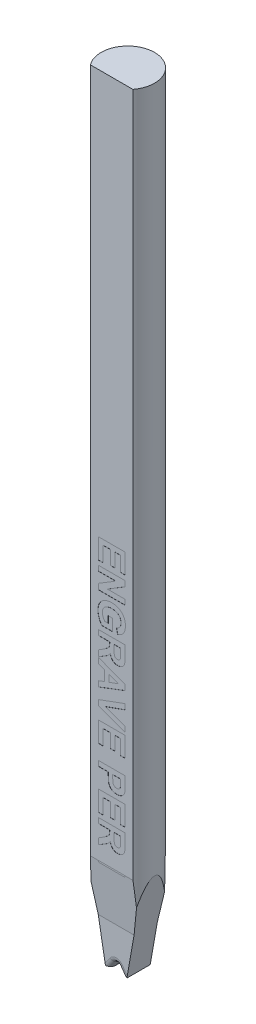
from build123d import *

# Parameters (mm, degrees)
SKETCH_TL_CUTTING_R       = 0.99695
TL_CUTTING_DEPTH          = 29.0068
SKETCH_TDF_GRINDING_W     = 2.0139
SKETCH_TDF_GRINDING_H     = 2.0139
TDF_GRINDING_DEPTH        = 30.041044486
ENGRAVING_DEPTH           = 0.005
VW_VR_GRINDING_DEPTH      = 1.00695
VW_VR_GRINDING_DEPTH_BACK = 1.00695
ISA_GRINDING_DEPTH        = 1.00695
ISA_GRINDING_DEPTH_BACK   = 1.00695
PRE_FRX_BRX_DEPTH         = 1.00695
PRE_FRX_BRX_DEPTH_BACK    = 1.00695
SKETCH_PRE_FRX_BRX_W      = 0.57134
SKETCH_PRE_FRX_BRX_H      = 1.524
FR_EDM_R                  = 0.20066
BR_EDM_R                  = 0.20066
FA_BA_GRINDING_DEPTH      = 1.00695
FA_BA_GRINDING_DEPTH_BACK = 1.00695


with BuildPart() as part:
    # sketch_TL_cutting → TL_cutting (new body)
    with BuildSketch(Plane(origin=(0, 0, 0), x_dir=(1, 0, 0), z_dir=(0, 1, 0))):
        Circle(SKETCH_TL_CUTTING_R)
    extrude(amount=TL_CUTTING_DEPTH)

    # sketch_TDF_grinding → TDF_grinding (cut, through all)
    with BuildSketch(Plane(origin=(0, 0, 0), x_dir=(1, 0, 0), z_dir=(0, 1, 0))):
        with Locations((0, -1.6102)):
            Rectangle(SKETCH_TDF_GRINDING_W, SKETCH_TDF_GRINDING_H)
    extrude(amount=TDF_GRINDING_DEPTH, mode=Mode.SUBTRACT)

    # sketch_engraving → engraving (cut)
    # profile 1 of 13: a face of its own
    with BuildSketch(Plane.XY.offset(0.60325)):
        Polygon((-0.5, 13.904235897), (0.5, 13.904235897), (0.5, 13.160646154), (0.333333333, 13.160646154), (0.333333333, 13.711928205), (0.115384615, 13.711928205), (0.115384615, 13.199107692), (-0.051282051, 13.199107692), (-0.051282051, 13.711928205), (-0.333333333, 13.711928205), (-0.333333333, 13.147825641), (-0.5, 13.147825641), align=None)
    # profile 2 of 13: a face of its own
    with BuildSketch(Plane.XY.offset(0.60325)):
        Polygon((-0.5, 12.981158974), (0.5, 12.981158974), (0.5, 12.7802375), (-0.157451923, 12.378594872), (0.5, 12.378594872), (0.5, 12.186287179), (-0.5, 12.186287179), (-0.5, 12.39341859), (0.147035256, 12.788851282), (-0.5, 12.788851282), align=None)
    # profile 3 of 13: a face of its own
    with BuildSketch(Plane.XY.offset(0.60325)):
        with BuildLine():
            Line((-0.128205128, 11.532441026), (0.038461538, 11.532441026))
            Line((0.038461538, 11.532441026), (0.038461538, 11.09654359))
            Line((0.038461538, 11.09654359), (-0.36338141, 11.09654359))
            add(Edge.make_bspline(
                [(-0.36338141, 11.09654359), (-0.368321434, 11.102029605), (-0.378419843, 11.113244131), (-0.392661125, 11.131541895), (-0.406257259, 11.15168601), (-0.4194836, 11.1735547), (-0.432233696, 11.197193223), (-0.444685123, 11.222507295), (-0.45671611, 11.249543622), (-0.471787381, 11.287776941), (-0.488186169, 11.336991061), (-0.502445448, 11.397156306), (-0.511191227, 11.457797498), (-0.512277771, 11.498358306), (-0.512820513, 11.51861891)],
                knots=[0, 0, 0, 0, 0.581799769, 1.189316438, 1.825828404, 2.496525428, 3.203088405, 3.942228803, 4.719818701, 5.534979611, 7.181138583, 8.803804008, 10.403462225, 12, 12, 12, 12], degree=3))
            add(Edge.make_bspline(
                [(-0.512820513, 11.51861891), (-0.512629241, 11.531311396), (-0.512252188, 11.556332062), (-0.509233571, 11.593270349), (-0.504017902, 11.628987455), (-0.496780719, 11.663419967), (-0.487836372, 11.696670877), (-0.476607913, 11.728623396), (-0.463065488, 11.759243299), (-0.447986133, 11.788759812), (-0.430657849, 11.816612408), (-0.411724289, 11.842856254), (-0.390891397, 11.867236635), (-0.36853351, 11.889965448), (-0.344060025, 11.910614033), (-0.318106216, 11.929695872), (-0.290219674, 11.946754268), (-0.260879177, 11.96208079), (-0.230317098, 11.975710173), (-0.198781008, 11.987212477), (-0.166726875, 11.997296153), (-0.134042675, 12.005583938), (-0.10062201, 12.011670885), (-0.066619552, 12.01640276), (-0.031822841, 12.018944234), (-0.008417054, 12.019393556), (0.003405449, 12.019620513)],
                knots=[0, 0, 0, 0, 1.124897971, 2.217508473, 3.282174662, 4.322209414, 5.334422951, 6.332119154, 7.320662553, 8.300074908, 9.267468154, 10.225199689, 11.165658754, 12.107290334, 13.047749399, 14.00069605, 14.959944213, 15.942088746, 16.933021067, 17.923599838, 18.915715637, 19.910475908, 20.909926025, 21.925232038, 22.952013513, 24, 24, 24, 24], degree=3))
            add(Edge.make_bspline(
                [(0.003405449, 12.019620513), (0.016165747, 12.019436614), (0.041321811, 12.019074069), (0.078501182, 12.015944425), (0.114594914, 12.01109647), (0.149519517, 12.003701478), (0.183523729, 11.994848027), (0.216299841, 11.983503339), (0.248180515, 11.970549892), (0.278688999, 11.955265774), (0.308028284, 11.938383202), (0.335510174, 11.919199631), (0.361403632, 11.89838003), (0.385591047, 11.875737199), (0.407627145, 11.850898237), (0.428063784, 11.824372539), (0.447146094, 11.79617769), (0.457908016, 11.776000967), (0.463341346, 11.765814423)],
                knots=[0, 0, 0, 0, 1.105132952, 2.178694671, 3.229818344, 4.257558797, 5.269123684, 6.27148554, 7.259679084, 8.247804916, 9.224967877, 10.189258471, 11.147685264, 12.101072275, 13.055511435, 14.02039165, 15.000562851, 16, 16, 16, 16], degree=3))
            add(Edge.make_bspline(
                [(0.463341346, 11.765814423), (0.467347168, 11.757727072), (0.475455657, 11.741356849), (0.485329628, 11.715283756), (0.494054347, 11.687916179), (0.500719187, 11.658934703), (0.506115234, 11.628648224), (0.510216979, 11.596907147), (0.512307439, 11.563652939), (0.512647258, 11.540990515), (0.512820513, 11.529436218)],
                knots=[0, 0, 0, 0, 0.887950456, 1.797368171, 2.741221183, 3.713797788, 4.722103116, 5.768966405, 6.862521341, 8, 8, 8, 8], degree=3))
            add(Edge.make_bspline(
                [(0.512820513, 11.529436218), (0.512598613, 11.514538718), (0.512167059, 11.485565835), (0.508571106, 11.443325541), (0.502373597, 11.403571904), (0.493837942, 11.366249565), (0.482863355, 11.331438928), (0.469371425, 11.299199918), (0.453633675, 11.26933466), (0.435019378, 11.242275716), (0.414494937, 11.217473149), (0.392035387, 11.19499168), (0.367607461, 11.174822262), (0.341334074, 11.156951549), (0.313106625, 11.141520198), (0.283182558, 11.128252182), (0.251334696, 11.117331), (0.22921692, 11.112053034), (0.217948718, 11.109364103)],
                knots=[0, 0, 0, 0, 1.271135529, 2.472123572, 3.614091059, 4.701890498, 5.736279567, 6.724681829, 7.680621489, 8.611506429, 9.52200816, 10.424540711, 11.318996785, 12.221421405, 13.131851814, 14.060431888, 15.011860567, 16, 16, 16, 16], degree=3))
            Line((0.217948718, 11.109364103), (0.179487179, 11.301671795))
            add(Edge.make_bspline(
                [(0.179487179, 11.301671795), (0.185798707, 11.303574377), (0.198251232, 11.307328136), (0.216108293, 11.314634712), (0.232994438, 11.322952834), (0.248643132, 11.332779827), (0.263649233, 11.343217482), (0.277161531, 11.355487665), (0.290187329, 11.368394684), (0.301701762, 11.38288584), (0.312086782, 11.398324395), (0.321450083, 11.414545863), (0.329043783, 11.431914205), (0.335153652, 11.450186828), (0.340342569, 11.469274233), (0.343533767, 11.489425571), (0.345940549, 11.51041453), (0.346081986, 11.524754556), (0.346153846, 11.532040385)],
                knots=[0, 0, 0, 0, 1.027780279, 2.027791312, 3.006028774, 3.96000864, 4.908113241, 5.852721087, 6.802883308, 7.765918715, 8.733730415, 9.704005314, 10.683351261, 11.68471758, 12.707948499, 13.764514378, 14.864202456, 16, 16, 16, 16], degree=3))
            add(Edge.make_bspline(
                [(0.346153846, 11.532040385), (0.345859633, 11.543067741), (0.34528545, 11.564588568), (0.341538784, 11.596006107), (0.334873123, 11.625645672), (0.325679114, 11.65358477), (0.313877959, 11.679874621), (0.299029501, 11.704159968), (0.282012344, 11.727045501), (0.262039987, 11.747879978), (0.239645267, 11.766774481), (0.214561065, 11.783131053), (0.186868462, 11.79674783), (0.156706511, 11.807900746), (0.124073954, 11.816780847), (0.088855272, 11.822804995), (0.051104495, 11.826741063), (0.02505068, 11.827118323), (0.01161859, 11.827312821)],
                knots=[0, 0, 0, 0, 1.043810997, 2.037086103, 2.989314757, 3.91471467, 4.817033861, 5.710208705, 6.603920097, 7.511448416, 8.435617211, 9.371747005, 10.338444094, 11.350425613, 12.411431869, 13.5347293, 14.729025275, 16, 16, 16, 16], degree=3))
            add(Edge.make_bspline(
                [(0.01161859, 11.827312821), (-0.002813331, 11.827110147), (-0.03086261, 11.826716238), (-0.071503034, 11.822881337), (-0.109371212, 11.816583116), (-0.14440027, 11.807515757), (-0.176807311, 11.796208494), (-0.206438048, 11.782228966), (-0.233109204, 11.76542113), (-0.256980675, 11.746358295), (-0.278169336, 11.725321484), (-0.296147735, 11.702258524), (-0.31184176, 11.678000317), (-0.32420794, 11.651860517), (-0.33413508, 11.624312028), (-0.341078682, 11.595085999), (-0.345395871, 11.564287729), (-0.345897627, 11.543206176), (-0.346153846, 11.532441026)],
                knots=[0, 0, 0, 0, 1.31821493, 2.562027667, 3.72541598, 4.821825939, 5.863743127, 6.857000185, 7.808227391, 8.737146514, 9.643023621, 10.529087527, 11.404035307, 12.277173472, 13.164790074, 14.074766194, 15.016892606, 16, 16, 16, 16], degree=3))
            add(Edge.make_bspline(
                [(-0.346153846, 11.532441026), (-0.345850315, 11.521537735), (-0.34524035, 11.499626847), (-0.340086045, 11.466805767), (-0.332449955, 11.433805514), (-0.321065283, 11.401413163), (-0.307937779, 11.370026456), (-0.292687307, 11.340860255), (-0.276962331, 11.313467677), (-0.264654274, 11.2969552), (-0.258613782, 11.288851282)],
                knots=[0, 0, 0, 0, 0.993779204, 1.997065276, 3.023588959, 4.078879359, 5.123947549, 6.123456565, 7.079038607, 8, 8, 8, 8], degree=3))
            Line((-0.258613782, 11.288851282), (-0.128205128, 11.288851282))
            Line((-0.128205128, 11.288851282), (-0.128205128, 11.532441026))
        make_face()
    # profile 4 of 13: a face of its own
    with BuildSketch(Plane.XY.offset(0.60325)):
        with BuildLine():
            Line((-0.5, 10.904235897), (0.5, 10.904235897))
            Line((0.5, 10.904235897), (0.5, 10.484564423))
            add(Edge.make_bspline(
                [(0.5, 10.484564423), (0.499921351, 10.471810201), (0.499769781, 10.447230481), (0.498665723, 10.411683268), (0.496349389, 10.378901265), (0.493735057, 10.348736822), (0.489890849, 10.321277094), (0.485377151, 10.296456079), (0.480042652, 10.274353829), (0.473762142, 10.2547266), (0.46640441, 10.236899938), (0.457825047, 10.220235326), (0.447696774, 10.204575272), (0.436444977, 10.189714477), (0.424039539, 10.175595254), (0.410155618, 10.162603274), (0.394999014, 10.150512567), (0.378696089, 10.139332781), (0.361318758, 10.129484096), (0.343425117, 10.120484982), (0.324824746, 10.113159364), (0.305605269, 10.10710847), (0.285808412, 10.102274923), (0.265383845, 10.098920032), (0.244368538, 10.096825611), (0.230173307, 10.096638641), (0.222956731, 10.09654359)],
                knots=[0, 0, 0, 0, 1.675792322, 3.229558513, 4.671612708, 5.993327294, 7.206773438, 8.313218507, 9.306927966, 10.191988363, 11.018030861, 11.838135071, 12.650980327, 13.465150207, 14.285535933, 15.117196726, 15.959844754, 16.83101188, 17.711363548, 18.582398133, 19.460517458, 20.334551361, 21.228266118, 22.135486512, 23.052118027, 24, 24, 24, 24], degree=3))
            add(Edge.make_bspline(
                [(0.222956731, 10.09654359), (0.213865176, 10.09671771), (0.196097772, 10.097057988), (0.170067915, 10.100259374), (0.145135532, 10.104860931), (0.121515047, 10.111974247), (0.099028777, 10.120818829), (0.077834712, 10.131624821), (0.057734109, 10.144377691), (0.039011166, 10.159143067), (0.021628172, 10.175861702), (0.005964946, 10.194627919), (-0.008142217, 10.215317705), (-0.020271369, 10.238100383), (-0.030960543, 10.262583224), (-0.039742833, 10.289088699), (-0.046961528, 10.31748005), (-0.050349413, 10.337234525), (-0.052083333, 10.347344872)],
                knots=[0, 0, 0, 0, 1.059179627, 2.069928931, 3.052909591, 4.01082991, 4.940120368, 5.865982481, 6.779263376, 7.710344595, 8.640547144, 9.585223395, 10.554458868, 11.553878165, 12.589111246, 13.664634927, 14.804759383, 16, 16, 16, 16], degree=3))
            add(Edge.make_bspline(
                [(-0.052083333, 10.347344872), (-0.058543192, 10.337554557), (-0.071157156, 10.318437315), (-0.092244136, 10.292140986), (-0.113935974, 10.268182324), (-0.13350323, 10.250195798), (-0.150629326, 10.236361316), (-0.165615492, 10.225228495), (-0.182859981, 10.213217912), (-0.202374991, 10.20044991), (-0.22398696, 10.186546224), (-0.248026974, 10.172024206), (-0.274260457, 10.156579885), (-0.292585876, 10.146196031), (-0.302083333, 10.140814423)],
                knots=[0, 0, 0, 0, 1.285482994, 2.510122655, 3.691653098, 4.826411195, 5.419869803, 6.105175889, 6.872935239, 7.723789235, 8.662129684, 9.690525463, 10.803075916, 12, 12, 12, 12], degree=3))
            Line((-0.302083333, 10.140814423), (-0.5, 10.019620513))
            Line((-0.5, 10.019620513), (-0.5, 10.244380128))
            Line((-0.5, 10.244380128), (-0.273036859, 10.386607692))
            add(Edge.make_bspline(
                [(-0.273036859, 10.386607692), (-0.263945443, 10.393137401), (-0.24658806, 10.405603957), (-0.221949287, 10.42363509), (-0.199893124, 10.440036608), (-0.1805544, 10.454827372), (-0.163731826, 10.467827709), (-0.149845803, 10.479482343), (-0.138230202, 10.489219639), (-0.126725879, 10.500254127), (-0.114887633, 10.513080533), (-0.103494307, 10.528942305), (-0.094238036, 10.545123543), (-0.087286311, 10.56262809), (-0.082478883, 10.582919627), (-0.079343719, 10.607279092), (-0.077067211, 10.636432144), (-0.076973557, 10.657502303), (-0.076923077, 10.668859295)],
                knots=[0, 0, 0, 0, 1.465382114, 2.797715724, 3.99708711, 5.063614826, 5.985194575, 6.779875669, 7.43696127, 7.968700361, 8.866038685, 9.717629234, 10.520014012, 11.30082289, 12.174340694, 13.242479345, 14.513673363, 16, 16, 16, 16], degree=3))
            Line((-0.076923077, 10.668859295), (-0.076923077, 10.711928205))
            Line((-0.076923077, 10.711928205), (-0.5, 10.711928205))
            Line((-0.5, 10.711928205), (-0.5, 10.904235897))
        make_face()
        with BuildLine():
            Line((0.08974359, 10.711928205), (0.08974359, 10.557080449))
            add(Edge.make_bspline(
                [(0.08974359, 10.557080449), (0.089768957, 10.5451274), (0.089817287, 10.522354821), (0.090527354, 10.489971991), (0.091115821, 10.461109113), (0.09265079, 10.435809153), (0.094114881, 10.414019334), (0.096069001, 10.395767128), (0.09836301, 10.381028848), (0.101931469, 10.366307986), (0.108148092, 10.351228202), (0.117003495, 10.335158518), (0.128487921, 10.321415466), (0.141777239, 10.309542986), (0.157332372, 10.300378485), (0.174706183, 10.293657484), (0.193862841, 10.289643774), (0.20724563, 10.289120802), (0.214142628, 10.288851282)],
                knots=[0, 0, 0, 0, 1.698120923, 3.235207303, 4.601799022, 5.7989489, 6.835765357, 7.704239165, 8.40605236, 8.953649664, 9.852072573, 10.714567413, 11.550246753, 12.383769498, 13.234656382, 14.099651817, 15.020630301, 16, 16, 16, 16], degree=3))
            add(Edge.make_bspline(
                [(0.214142628, 10.288851282), (0.221852989, 10.28918604), (0.236728888, 10.2898319), (0.257822961, 10.295086949), (0.27662771, 10.303834428), (0.292813882, 10.316323618), (0.306623576, 10.33192236), (0.317392842, 10.350646681), (0.325576055, 10.372091747), (0.328565774, 10.387545804), (0.330128205, 10.395622115)],
                knots=[0, 0, 0, 0, 1.062451802, 2.049829439, 2.976851779, 3.903462222, 4.849641532, 5.832195941, 6.867102576, 8, 8, 8, 8], degree=3))
            add(Edge.make_bspline(
                [(0.330128205, 10.395622115), (0.330421459, 10.398291011), (0.331116534, 10.404616853), (0.331562949, 10.415787541), (0.332249138, 10.430070698), (0.332529569, 10.447639208), (0.333021138, 10.468336115), (0.333111403, 10.492243719), (0.333399792, 10.519286063), (0.333356297, 10.538383752), (0.333333333, 10.548466667)],
                knots=[0, 0, 0, 0, 0.42127143, 0.998501726, 1.753681744, 2.66564073, 3.755712164, 5.002818897, 6.417592707, 8, 8, 8, 8], degree=3))
            Line((0.333333333, 10.548466667), (0.333333333, 10.711928205))
            Line((0.333333333, 10.711928205), (0.08974359, 10.711928205))
        make_face(mode=Mode.SUBTRACT)
    # profile 5 of 13: a face of its own
    with BuildSketch(Plane.XY.offset(0.60325)):
        Polygon((-0.5, 9.045261538), (-0.5, 9.249187821), (-0.269230769, 9.333522756), (-0.269230769, 9.717336859), (-0.5, 9.801671795), (-0.5, 10.0068), (0.5, 9.628795192), (0.5, 9.425069231), align=None)
        Polygon((-0.102564103, 9.394620513), (0.256410256, 9.526030769), (-0.102564103, 9.657040385), align=None, mode=Mode.SUBTRACT)
    # profile 6 of 13: a face of its own
    with BuildSketch(Plane.XY.offset(0.60325)):
        Polygon((-0.5, 8.637008333), (0.5, 9.0068), (0.5, 8.803675), (-0.243589744, 8.538851282), (0.5, 8.275029167), (0.5, 8.070902564), (-0.5, 8.439291987), align=None)
    # profile 7 of 13: a face of its own
    with BuildSketch(Plane.XY.offset(0.60325)):
        Polygon((-0.5, 7.981158974), (0.5, 7.981158974), (0.5, 7.237569231), (0.333333333, 7.237569231), (0.333333333, 7.788851282), (0.115384615, 7.788851282), (0.115384615, 7.276030769), (-0.051282051, 7.276030769), (-0.051282051, 7.788851282), (-0.333333333, 7.788851282), (-0.333333333, 7.224748718), (-0.5, 7.224748718), align=None)
    # profile 8 of 13: a face of its own
    with BuildSketch(Plane.XY.offset(0.60325)):
        with BuildLine():
            Line((-0.5, 6.673466667), (0.5, 6.673466667))
            Line((0.5, 6.673466667), (0.5, 6.353554808))
            add(Edge.make_bspline(
                [(0.5, 6.353554808), (0.4999852, 6.339064455), (0.499956962, 6.311416693), (0.499104777, 6.271884062), (0.497929464, 6.236289855), (0.496434625, 6.204622803), (0.494248137, 6.176966334), (0.491629455, 6.153258956), (0.488933209, 6.133391744), (0.486060508, 6.121634128), (0.484775641, 6.116375321)],
                knots=[0, 0, 0, 0, 1.460492613, 2.786636817, 3.985312262, 5.05006335, 5.98179196, 6.7807735, 7.454678796, 8, 8, 8, 8], degree=3))
            add(Edge.make_bspline(
                [(0.484775641, 6.116375321), (0.482781564, 6.109381959), (0.478823789, 6.095501776), (0.470386441, 6.075615803), (0.460608006, 6.05644887), (0.448953875, 6.038241805), (0.435630967, 6.020932663), (0.420747869, 6.004470188), (0.404237636, 5.988765844), (0.386131953, 5.974039765), (0.366525691, 5.960543742), (0.345376234, 5.948912401), (0.322847402, 5.939051925), (0.298873329, 5.931127517), (0.273610941, 5.924575617), (0.246834559, 5.920393024), (0.218752408, 5.917369504), (0.199528035, 5.9171623), (0.189703526, 5.91705641)],
                knots=[0, 0, 0, 0, 0.907183394, 1.800546498, 2.691728384, 3.591410291, 4.495216108, 5.416087871, 6.359626967, 7.337496937, 8.327236581, 9.327316132, 10.346534403, 11.393207653, 12.477041209, 13.600953845, 14.773980723, 16, 16, 16, 16], degree=3))
            add(Edge.make_bspline(
                [(0.189703526, 5.91705641), (0.174784734, 5.917364918), (0.146065241, 5.917958813), (0.104894137, 5.924608263), (0.067280604, 5.934741168), (0.03361575, 5.949582122), (0.003633111, 5.967595209), (-0.023091697, 5.987763014), (-0.046492635, 6.010246245), (-0.066210989, 6.034825478), (-0.082434, 6.060756803), (-0.096247437, 6.086755341), (-0.106871469, 6.113146515), (-0.11149992, 6.13114078), (-0.113782051, 6.140013141)],
                knots=[0, 0, 0, 0, 1.312446177, 2.526530956, 3.662051072, 4.733637382, 5.754065268, 6.735959421, 7.675686778, 8.604015004, 9.502732733, 10.365317746, 11.193993632, 12, 12, 12, 12], degree=3))
            add(Edge.make_bspline(
                [(-0.113782051, 6.140013141), (-0.114986663, 6.146345752), (-0.11752584, 6.159694139), (-0.120056937, 6.180863883), (-0.122858586, 6.204003561), (-0.124685978, 6.229208347), (-0.126397255, 6.25644775), (-0.127205205, 6.285711194), (-0.128178621, 6.316956857), (-0.128196112, 6.338463031), (-0.128205128, 6.349548397)],
                knots=[0, 0, 0, 0, 0.735353946, 1.55003838, 2.431865514, 3.394945452, 4.432993119, 5.54609699, 6.735134699, 8, 8, 8, 8], degree=3))
            Line((-0.128205128, 6.349548397), (-0.128205128, 6.481158974))
            Line((-0.128205128, 6.481158974), (-0.5, 6.481158974))
            Line((-0.5, 6.481158974), (-0.5, 6.673466667))
        make_face()
        with BuildLine():
            Line((0.333333333, 6.481158974), (0.038461538, 6.481158974))
            Line((0.038461538, 6.481158974), (0.038461538, 6.365774359))
            add(Edge.make_bspline(
                [(0.038461538, 6.365774359), (0.038474423, 6.355824233), (0.038499073, 6.33678839), (0.039383856, 6.309476178), (0.040463899, 6.284753138), (0.04225159, 6.262567611), (0.044607724, 6.243053517), (0.047425958, 6.226080173), (0.050450217, 6.211627797), (0.055461898, 6.19599952), (0.063570342, 6.179289767), (0.075224213, 6.161445715), (0.089157789, 6.145769737), (0.105522293, 6.132725245), (0.123704204, 6.122305583), (0.143517189, 6.114845099), (0.164632877, 6.11002787), (0.179260262, 6.109587861), (0.186698718, 6.109364103)],
                knots=[0, 0, 0, 0, 1.411705958, 2.700771114, 3.876961699, 4.922619712, 5.858038221, 6.66485904, 7.363650596, 7.950905807, 8.989198271, 9.987739806, 10.967313358, 11.951275539, 12.944273208, 13.927870418, 14.946261014, 16, 16, 16, 16], degree=3))
            add(Edge.make_bspline(
                [(0.186698718, 6.109364103), (0.195758642, 6.109679017), (0.213324639, 6.110289596), (0.238341551, 6.11702257), (0.261044702, 6.127410781), (0.280727694, 6.142262972), (0.297279472, 6.16020407), (0.31105114, 6.180369116), (0.320688658, 6.203188742), (0.32442284, 6.219338921), (0.326322115, 6.227553205)],
                knots=[0, 0, 0, 0, 1.085904563, 2.105425768, 3.088705091, 4.068969419, 5.045188284, 6.010769642, 6.988240112, 8, 8, 8, 8], degree=3))
            add(Edge.make_bspline(
                [(0.326322115, 6.227553205), (0.326887477, 6.231087999), (0.328142404, 6.238934146), (0.329452077, 6.251976039), (0.330643223, 6.267404601), (0.331621189, 6.285238428), (0.332385732, 6.305406833), (0.333055661, 6.32797634), (0.333109481, 6.352887507), (0.333256648, 6.37031512), (0.333333333, 6.379396154)],
                knots=[0, 0, 0, 0, 0.564603001, 1.253243608, 2.066786758, 3.005752288, 4.070476343, 5.250658742, 6.567396469, 8, 8, 8, 8], degree=3))
            Line((0.333333333, 6.379396154), (0.333333333, 6.481158974))
        make_face(mode=Mode.SUBTRACT)
    # profile 9 of 13: a face of its own
    with BuildSketch(Plane.XY.offset(0.60325)):
        Polygon((-0.5, 5.750389744), (0.5, 5.750389744), (0.5, 5.0068), (0.333333333, 5.0068), (0.333333333, 5.558082051), (0.115384615, 5.558082051), (0.115384615, 5.045261538), (-0.051282051, 5.045261538), (-0.051282051, 5.558082051), (-0.333333333, 5.558082051), (-0.333333333, 4.993979487), (-0.5, 4.993979487), align=None)
    # profile 10 of 13: a face of its own
    with BuildSketch(Plane.XY.offset(0.60325)):
        with BuildLine():
            Line((-0.5, 4.827312821), (0.5, 4.827312821))
            Line((0.5, 4.827312821), (0.5, 4.407641346))
            add(Edge.make_bspline(
                [(0.5, 4.407641346), (0.499921351, 4.394887124), (0.499769781, 4.370307404), (0.498665723, 4.334760191), (0.496349389, 4.301978188), (0.493735057, 4.271813745), (0.489890849, 4.244354017), (0.485377151, 4.219533002), (0.480042652, 4.197430752), (0.473762142, 4.177803523), (0.46640441, 4.159976861), (0.457825047, 4.143312249), (0.447696774, 4.127652195), (0.436444977, 4.1127914), (0.424039539, 4.098672178), (0.410155618, 4.085680198), (0.394999014, 4.07358949), (0.378696089, 4.062409704), (0.361318758, 4.052561019), (0.343425117, 4.043561905), (0.324824746, 4.036236287), (0.305605269, 4.030185393), (0.285808412, 4.025351846), (0.265383845, 4.021996956), (0.244368538, 4.019902534), (0.230173307, 4.019715564), (0.222956731, 4.019620513)],
                knots=[0, 0, 0, 0, 1.675792322, 3.229558513, 4.671612708, 5.993327294, 7.206773438, 8.313218507, 9.306927966, 10.191988363, 11.018030861, 11.838135071, 12.650980327, 13.465150207, 14.285535933, 15.117196726, 15.959844754, 16.83101188, 17.711363548, 18.582398133, 19.460517458, 20.334551361, 21.228266118, 22.135486512, 23.052118027, 24, 24, 24, 24], degree=3))
            add(Edge.make_bspline(
                [(0.222956731, 4.019620513), (0.213865176, 4.019794633), (0.196097772, 4.020134911), (0.170067915, 4.023336297), (0.145135532, 4.027937854), (0.121515047, 4.03505117), (0.099028777, 4.043895752), (0.077834712, 4.054701744), (0.057734109, 4.067454614), (0.039011166, 4.08221999), (0.021628172, 4.098938625), (0.005964946, 4.117704843), (-0.008142217, 4.138394628), (-0.020271369, 4.161177306), (-0.030960543, 4.185660147), (-0.039742833, 4.212165622), (-0.046961528, 4.240556973), (-0.050349413, 4.260311448), (-0.052083333, 4.270421795)],
                knots=[0, 0, 0, 0, 1.059179627, 2.069928931, 3.052909591, 4.01082991, 4.940120368, 5.865982481, 6.779263376, 7.710344595, 8.640547144, 9.585223395, 10.554458868, 11.553878165, 12.589111246, 13.664634927, 14.804759383, 16, 16, 16, 16], degree=3))
            add(Edge.make_bspline(
                [(-0.052083333, 4.270421795), (-0.058543192, 4.26063148), (-0.071157156, 4.241514238), (-0.092244136, 4.215217909), (-0.113935974, 4.191259247), (-0.13350323, 4.173272722), (-0.150629326, 4.159438239), (-0.165615492, 4.148305418), (-0.182859981, 4.136294835), (-0.202374991, 4.123526833), (-0.22398696, 4.109623147), (-0.248026974, 4.095101129), (-0.274260457, 4.079656808), (-0.292585876, 4.069272954), (-0.302083333, 4.063891346)],
                knots=[0, 0, 0, 0, 1.285482994, 2.510122655, 3.691653098, 4.826411195, 5.419869803, 6.105175889, 6.872935239, 7.723789235, 8.662129684, 9.690525463, 10.803075916, 12, 12, 12, 12], degree=3))
            Line((-0.302083333, 4.063891346), (-0.5, 3.942697436))
            Line((-0.5, 3.942697436), (-0.5, 4.167457051))
            Line((-0.5, 4.167457051), (-0.273036859, 4.309684615))
            add(Edge.make_bspline(
                [(-0.273036859, 4.309684615), (-0.263945443, 4.316214324), (-0.24658806, 4.32868088), (-0.221949287, 4.346712013), (-0.199893124, 4.363113531), (-0.1805544, 4.377904295), (-0.163731826, 4.390904632), (-0.149845803, 4.402559266), (-0.138230202, 4.412296562), (-0.126725879, 4.42333105), (-0.114887633, 4.436157456), (-0.103494307, 4.452019228), (-0.094238036, 4.468200466), (-0.087286311, 4.485705013), (-0.082478883, 4.505996551), (-0.079343719, 4.530356015), (-0.077067211, 4.559509067), (-0.076973557, 4.580579226), (-0.076923077, 4.591936218)],
                knots=[0, 0, 0, 0, 1.465382114, 2.797715724, 3.99708711, 5.063614826, 5.985194575, 6.779875669, 7.43696127, 7.968700361, 8.866038685, 9.717629234, 10.520014012, 11.30082289, 12.174340694, 13.242479345, 14.513673363, 16, 16, 16, 16], degree=3))
            Line((-0.076923077, 4.591936218), (-0.076923077, 4.635005128))
            Line((-0.076923077, 4.635005128), (-0.5, 4.635005128))
            Line((-0.5, 4.635005128), (-0.5, 4.827312821))
        make_face()
        with BuildLine():
            Line((0.08974359, 4.635005128), (0.08974359, 4.480157372))
            add(Edge.make_bspline(
                [(0.08974359, 4.480157372), (0.089768957, 4.468204323), (0.089817287, 4.445431744), (0.090527354, 4.413048914), (0.091115821, 4.384186036), (0.09265079, 4.358886076), (0.094114881, 4.337096257), (0.096069001, 4.318844051), (0.09836301, 4.304105771), (0.101931469, 4.289384909), (0.108148092, 4.274305125), (0.117003495, 4.258235441), (0.128487921, 4.244492389), (0.141777239, 4.232619909), (0.157332372, 4.223455408), (0.174706183, 4.216734407), (0.193862841, 4.212720697), (0.20724563, 4.212197726), (0.214142628, 4.211928205)],
                knots=[0, 0, 0, 0, 1.698120923, 3.235207303, 4.601799022, 5.7989489, 6.835765357, 7.704239165, 8.40605236, 8.953649664, 9.852072573, 10.714567413, 11.550246753, 12.383769498, 13.234656382, 14.099651817, 15.020630301, 16, 16, 16, 16], degree=3))
            add(Edge.make_bspline(
                [(0.214142628, 4.211928205), (0.221852989, 4.212262963), (0.236728888, 4.212908823), (0.257822961, 4.218163872), (0.27662771, 4.226911351), (0.292813882, 4.239400541), (0.306623576, 4.254999283), (0.317392842, 4.273723604), (0.325576055, 4.29516867), (0.328565774, 4.310622727), (0.330128205, 4.318699038)],
                knots=[0, 0, 0, 0, 1.062451802, 2.049829439, 2.976851779, 3.903462222, 4.849641532, 5.832195941, 6.867102576, 8, 8, 8, 8], degree=3))
            add(Edge.make_bspline(
                [(0.330128205, 4.318699038), (0.330421459, 4.321367934), (0.331116534, 4.327693776), (0.331562949, 4.338864464), (0.332249138, 4.353147621), (0.332529569, 4.370716131), (0.333021138, 4.391413038), (0.333111403, 4.415320642), (0.333399792, 4.442362986), (0.333356297, 4.461460675), (0.333333333, 4.47154359)],
                knots=[0, 0, 0, 0, 0.42127143, 0.998501726, 1.753681744, 2.66564073, 3.755712164, 5.002818897, 6.417592707, 8, 8, 8, 8], degree=3))
            Line((0.333333333, 4.47154359), (0.333333333, 4.635005128))
            Line((0.333333333, 4.635005128), (0.08974359, 4.635005128))
        make_face(mode=Mode.SUBTRACT)
    # profile 11 of 13: a face of its own
    with BuildSketch(Plane.XY.offset(0.60325)):
        with BuildLine():
            Line((0.5, 3.442697436), (0.5, 3.075910577))
            add(Edge.make_bspline(
                [(0.5, 3.075910577), (0.500005193, 3.065893032), (0.500015306, 3.046386546), (0.498840892, 3.018077527), (0.497659587, 2.991604956), (0.495294873, 2.967044813), (0.492816233, 2.944311894), (0.489678088, 2.923365404), (0.485656212, 2.904337663), (0.482484481, 2.892338781), (0.480969551, 2.886607692)],
                knots=[0, 0, 0, 0, 1.259756885, 2.453039283, 3.563158368, 4.591894114, 5.55549294, 6.43918076, 7.254497783, 8, 8, 8, 8], degree=3))
            add(Edge.make_bspline(
                [(0.480969551, 2.886607692), (0.478637325, 2.879438716), (0.474014881, 2.865229893), (0.465827813, 2.84437684), (0.455960096, 2.824542941), (0.445111978, 2.80526828), (0.432903728, 2.786996015), (0.419595761, 2.769281335), (0.404753223, 2.752648264), (0.383633179, 2.731113601), (0.35420815, 2.706688717), (0.315375005, 2.680858181), (0.272594656, 2.659120476), (0.234409605, 2.643929103), (0.20183843, 2.633885004), (0.175754603, 2.627316602), (0.148301213, 2.621644929), (0.119383738, 2.617394754), (0.08913491, 2.613733367), (0.057465542, 2.611105699), (0.024383276, 2.609804712), (0.001870575, 2.609512956), (-0.009615385, 2.609364103)],
                knots=[0, 0, 0, 0, 0.745431882, 1.477436776, 2.212739876, 2.934276521, 3.663147754, 4.384200836, 5.123377481, 5.865761747, 7.365547505, 8.894711587, 10.468722596, 12.101948761, 12.951987285, 13.837595333, 14.760899389, 15.722756883, 16.726861385, 17.773652936, 18.864119771, 20, 20, 20, 20], degree=3))
            add(Edge.make_bspline(
                [(-0.009615385, 2.609364103), (-0.0294616, 2.609755507), (-0.067834928, 2.610512302), (-0.123301552, 2.616109673), (-0.17465514, 2.62540511), (-0.206804138, 2.635115536), (-0.222355769, 2.639812821)],
                knots=[0, 0, 0, 0, 1.103491527, 2.133638164, 3.0971734, 4, 4, 4, 4], degree=3))
            add(Edge.make_bspline(
                [(-0.222355769, 2.639812821), (-0.231274521, 2.642986465), (-0.248819098, 2.649229518), (-0.274127236, 2.660154394), (-0.298211673, 2.671958799), (-0.321053432, 2.684740646), (-0.342549771, 2.698564513), (-0.362636394, 2.713482107), (-0.381577746, 2.729262192), (-0.393236239, 2.740693951), (-0.399038462, 2.746383333)],
                knots=[0, 0, 0, 0, 1.090884612, 2.145940218, 3.175104604, 4.181306866, 5.161203701, 6.118658341, 7.063689906, 8, 8, 8, 8], degree=3))
            add(Edge.make_bspline(
                [(-0.399038462, 2.746383333), (-0.407300305, 2.755669607), (-0.424264154, 2.774736893), (-0.445652736, 2.808088411), (-0.464086504, 2.845963738), (-0.473760833, 2.873277629), (-0.478766026, 2.887408974)],
                knots=[0, 0, 0, 0, 0.912008655, 1.872605891, 2.89935344, 4, 4, 4, 4], degree=3))
            add(Edge.make_bspline(
                [(-0.478766026, 2.887408974), (-0.4805228, 2.893128948), (-0.484168894, 2.905000457), (-0.488062998, 2.923823906), (-0.492165475, 2.943918409), (-0.49463687, 2.965515685), (-0.497243066, 2.988391543), (-0.498706299, 3.012728283), (-0.49974511, 3.038441542), (-0.499913777, 3.056077636), (-0.5, 3.065093269)],
                knots=[0, 0, 0, 0, 0.799129865, 1.658552685, 2.566799617, 3.538529252, 4.561352959, 5.643373779, 6.795284424, 8, 8, 8, 8], degree=3))
            Line((-0.5, 3.065093269), (-0.5, 3.442697436))
            Line((-0.5, 3.442697436), (0.5, 3.442697436))
        make_face()
        with BuildLine():
            Line((0.333333333, 3.250389744), (-0.333333333, 3.250389744))
            Line((-0.333333333, 3.250389744), (-0.333333333, 3.092136538))
            add(Edge.make_bspline(
                [(-0.333333333, 3.092136538), (-0.333276671, 3.084991821), (-0.333167574, 3.071235511), (-0.332847006, 3.051329778), (-0.331979167, 3.033036576), (-0.331080228, 3.016260076), (-0.329595022, 3.001043952), (-0.328134266, 2.987321997), (-0.326090699, 2.975170593), (-0.324477534, 2.967665588), (-0.323717949, 2.964131731)],
                knots=[0, 0, 0, 0, 1.333384787, 2.567275092, 3.714769766, 4.750907381, 5.701951617, 6.567520054, 7.325492842, 8, 8, 8, 8], degree=3))
            add(Edge.make_bspline(
                [(-0.323717949, 2.964131731), (-0.321509316, 2.955855036), (-0.317207482, 2.939734219), (-0.307617456, 2.917098961), (-0.296048139, 2.896616969), (-0.282136533, 2.877945232), (-0.26455548, 2.861118131), (-0.242070693, 2.846754145), (-0.215254411, 2.833460653), (-0.189584523, 2.824357267), (-0.16665678, 2.817822874), (-0.147412959, 2.813399626), (-0.126593091, 2.809904053), (-0.104279343, 2.806897404), (-0.080500412, 2.80446796), (-0.055170426, 2.802956245), (-0.028320392, 2.80192449), (-0.009883527, 2.801757622), (-0.000400641, 2.801671795)],
                knots=[0, 0, 0, 0, 1.038686998, 2.023088296, 2.974059649, 3.888265163, 4.839857954, 5.909819677, 7.113156087, 8.466843969, 9.20827164, 10.006482943, 10.861893492, 11.769681931, 12.739021491, 13.762258324, 14.849031541, 16, 16, 16, 16], degree=3))
            add(Edge.make_bspline(
                [(-0.000400641, 2.801671795), (0.009082275, 2.801756962), (0.027452469, 2.801921946), (0.054102292, 2.802952126), (0.079033415, 2.804455325), (0.102276578, 2.806902152), (0.123864169, 2.809861918), (0.143813574, 2.813399353), (0.161996804, 2.817792884), (0.183589283, 2.824345973), (0.207947697, 2.834183458), (0.23429421, 2.848009661), (0.2571147, 2.864274863), (0.276689574, 2.882630019), (0.29287817, 2.903717031), (0.306422028, 2.927087832), (0.316938162, 2.953218741), (0.321416742, 2.971807779), (0.323717949, 2.981359295)],
                knots=[0, 0, 0, 0, 1.118059345, 2.165891593, 3.144157881, 4.062285166, 4.920717571, 5.712910489, 6.449981617, 7.12489426, 8.371943983, 9.541298068, 10.624898781, 11.666293176, 12.69306237, 13.747704633, 14.842713931, 16, 16, 16, 16], degree=3))
            add(Edge.make_bspline(
                [(0.323717949, 2.981359295), (0.324486218, 2.985493605), (0.326177652, 2.994595773), (0.328151987, 3.009700032), (0.329628909, 3.02748664), (0.331099472, 3.047915577), (0.331977905, 3.070965526), (0.332859431, 3.096671032), (0.333166326, 3.125055313), (0.333276065, 3.144887669), (0.333333333, 3.1552375)],
                knots=[0, 0, 0, 0, 0.578739524, 1.274162912, 2.095457587, 3.035141998, 4.093102578, 5.270121571, 6.575369351, 8, 8, 8, 8], degree=3))
            Line((0.333333333, 3.1552375), (0.333333333, 3.250389744))
        make_face(mode=Mode.SUBTRACT)
    # profile 12 of 13: a face of its own
    with BuildSketch(Plane.XY.offset(0.60325)):
        Polygon((-0.5, 2.305878526), (0.5, 2.545261538), (0.5, 2.348146154), (-0.186899038, 2.192697436), (0.5, 2.028234295), (0.5, 1.765814423), (-0.198517628, 1.602953846), (0.5, 1.447905769), (0.5, 1.250389744), (-0.5, 1.485365705), (-0.5, 1.723546795), (0.247596154, 1.897825641), (-0.5, 2.076711859), align=None)
    # profile 13 of 13: a face of its own
    with BuildSketch(Plane.XY.offset(0.60325)):
        with BuildLine():
            Line((-0.128205128, 0.686287179), (0.038461538, 0.686287179))
            Line((0.038461538, 0.686287179), (0.038461538, 0.250389744))
            Line((0.038461538, 0.250389744), (-0.36338141, 0.250389744))
            add(Edge.make_bspline(
                [(-0.36338141, 0.250389744), (-0.368321434, 0.255875759), (-0.378419843, 0.267090285), (-0.392661125, 0.285388049), (-0.406257259, 0.305532164), (-0.4194836, 0.327400854), (-0.432233696, 0.351039376), (-0.444685123, 0.376353449), (-0.45671611, 0.403389776), (-0.471787381, 0.441623095), (-0.488186169, 0.490837215), (-0.502445448, 0.55100246), (-0.511191227, 0.611643651), (-0.512277771, 0.65220446), (-0.512820513, 0.672465064)],
                knots=[0, 0, 0, 0, 0.581799769, 1.189316438, 1.825828404, 2.496525428, 3.203088405, 3.942228803, 4.719818701, 5.534979611, 7.181138583, 8.803804008, 10.403462225, 12, 12, 12, 12], degree=3))
            add(Edge.make_bspline(
                [(-0.512820513, 0.672465064), (-0.512629241, 0.68515755), (-0.512252188, 0.710178215), (-0.509233571, 0.747116503), (-0.504017902, 0.782833609), (-0.496780719, 0.817266121), (-0.487836372, 0.85051703), (-0.476607913, 0.88246955), (-0.463065488, 0.913089453), (-0.447986133, 0.942605966), (-0.430657849, 0.970458562), (-0.411724289, 0.996702408), (-0.390891397, 1.021082789), (-0.36853351, 1.043811601), (-0.344060025, 1.064460187), (-0.318106216, 1.083542026), (-0.290219674, 1.100600422), (-0.260879177, 1.115926944), (-0.230317098, 1.129556327), (-0.198781008, 1.14105863), (-0.166726875, 1.151142307), (-0.134042675, 1.159430092), (-0.10062201, 1.165517039), (-0.066619552, 1.170248914), (-0.031822841, 1.172790388), (-0.008417054, 1.17323971), (0.003405449, 1.173466667)],
                knots=[0, 0, 0, 0, 1.124897971, 2.217508473, 3.282174662, 4.322209414, 5.334422951, 6.332119154, 7.320662553, 8.300074908, 9.267468154, 10.225199689, 11.165658754, 12.107290334, 13.047749399, 14.00069605, 14.959944213, 15.942088746, 16.933021067, 17.923599838, 18.915715637, 19.910475908, 20.909926025, 21.925232038, 22.952013513, 24, 24, 24, 24], degree=3))
            add(Edge.make_bspline(
                [(0.003405449, 1.173466667), (0.016165747, 1.173282768), (0.041321811, 1.172920223), (0.078501182, 1.169790579), (0.114594914, 1.164942624), (0.149519517, 1.157547632), (0.183523729, 1.14869418), (0.216299841, 1.137349493), (0.248180515, 1.124396046), (0.278688999, 1.109111928), (0.308028284, 1.092229356), (0.335510174, 1.073045784), (0.361403632, 1.052226184), (0.385591047, 1.029583353), (0.407627145, 1.004744391), (0.428063784, 0.978218692), (0.447146094, 0.950023844), (0.457908016, 0.929847121), (0.463341346, 0.919660577)],
                knots=[0, 0, 0, 0, 1.105132952, 2.178694671, 3.229818344, 4.257558797, 5.269123684, 6.27148554, 7.259679084, 8.247804916, 9.224967877, 10.189258471, 11.147685264, 12.101072275, 13.055511435, 14.02039165, 15.000562851, 16, 16, 16, 16], degree=3))
            add(Edge.make_bspline(
                [(0.463341346, 0.919660577), (0.467347168, 0.911573226), (0.475455657, 0.895203002), (0.485329628, 0.869129909), (0.494054347, 0.841762333), (0.500719187, 0.812780857), (0.506115234, 0.782494378), (0.510216979, 0.750753301), (0.512307439, 0.717499093), (0.512647258, 0.694836668), (0.512820513, 0.683282372)],
                knots=[0, 0, 0, 0, 0.887950456, 1.797368171, 2.741221183, 3.713797788, 4.722103116, 5.768966405, 6.862521341, 8, 8, 8, 8], degree=3))
            add(Edge.make_bspline(
                [(0.512820513, 0.683282372), (0.512598613, 0.668384872), (0.512167059, 0.639411989), (0.508571106, 0.597171695), (0.502373597, 0.557418058), (0.493837942, 0.520095719), (0.482863355, 0.485285082), (0.469371425, 0.453046072), (0.453633675, 0.423180814), (0.435019378, 0.396121869), (0.414494937, 0.371319302), (0.392035387, 0.348837834), (0.367607461, 0.328668415), (0.341334074, 0.310797703), (0.313106625, 0.295366351), (0.283182558, 0.282098336), (0.251334696, 0.271177154), (0.22921692, 0.265899188), (0.217948718, 0.263210256)],
                knots=[0, 0, 0, 0, 1.271135529, 2.472123572, 3.614091059, 4.701890498, 5.736279567, 6.724681829, 7.680621489, 8.611506429, 9.52200816, 10.424540711, 11.318996785, 12.221421405, 13.131851814, 14.060431888, 15.011860567, 16, 16, 16, 16], degree=3))
            Line((0.217948718, 0.263210256), (0.179487179, 0.455517949))
            add(Edge.make_bspline(
                [(0.179487179, 0.455517949), (0.185798707, 0.457420531), (0.198251232, 0.461174289), (0.216108293, 0.468480866), (0.232994438, 0.476798988), (0.248643132, 0.486625981), (0.263649233, 0.497063636), (0.277161531, 0.509333819), (0.290187329, 0.522240837), (0.301701762, 0.536731994), (0.312086782, 0.552170549), (0.321450083, 0.568392017), (0.329043783, 0.585760359), (0.335153652, 0.604032982), (0.340342569, 0.623120387), (0.343533767, 0.643271725), (0.345940549, 0.664260684), (0.346081986, 0.67860071), (0.346153846, 0.685886538)],
                knots=[0, 0, 0, 0, 1.027780279, 2.027791312, 3.006028774, 3.96000864, 4.908113241, 5.852721087, 6.802883308, 7.765918715, 8.733730415, 9.704005314, 10.683351261, 11.68471758, 12.707948499, 13.764514378, 14.864202456, 16, 16, 16, 16], degree=3))
            add(Edge.make_bspline(
                [(0.346153846, 0.685886538), (0.345859633, 0.696913895), (0.34528545, 0.718434722), (0.341538784, 0.749852261), (0.334873123, 0.779491826), (0.325679114, 0.807430924), (0.313877959, 0.833720775), (0.299029501, 0.858006122), (0.282012344, 0.880891655), (0.262039987, 0.901726131), (0.239645267, 0.920620635), (0.214561065, 0.936977207), (0.186868462, 0.950593984), (0.156706511, 0.9617469), (0.124073954, 0.970627), (0.088855272, 0.976651148), (0.051104495, 0.980587217), (0.02505068, 0.980964477), (0.01161859, 0.981158974)],
                knots=[0, 0, 0, 0, 1.043810997, 2.037086103, 2.989314757, 3.91471467, 4.817033861, 5.710208705, 6.603920097, 7.511448416, 8.435617211, 9.371747005, 10.338444094, 11.350425613, 12.411431869, 13.5347293, 14.729025275, 16, 16, 16, 16], degree=3))
            add(Edge.make_bspline(
                [(0.01161859, 0.981158974), (-0.002813331, 0.9809563), (-0.03086261, 0.980562392), (-0.071503034, 0.976727491), (-0.109371212, 0.970429269), (-0.14440027, 0.961361911), (-0.176807311, 0.950054648), (-0.206438048, 0.93607512), (-0.233109204, 0.919267284), (-0.256980675, 0.900204449), (-0.278169336, 0.879167638), (-0.296147735, 0.856104678), (-0.31184176, 0.83184647), (-0.32420794, 0.805706671), (-0.33413508, 0.778158182), (-0.341078682, 0.748932153), (-0.345395871, 0.718133883), (-0.345897627, 0.69705233), (-0.346153846, 0.686287179)],
                knots=[0, 0, 0, 0, 1.31821493, 2.562027667, 3.72541598, 4.821825939, 5.863743127, 6.857000185, 7.808227391, 8.737146514, 9.643023621, 10.529087527, 11.404035307, 12.277173472, 13.164790074, 14.074766194, 15.016892606, 16, 16, 16, 16], degree=3))
            add(Edge.make_bspline(
                [(-0.346153846, 0.686287179), (-0.345850315, 0.675383888), (-0.34524035, 0.653473001), (-0.340086045, 0.620651921), (-0.332449955, 0.587651668), (-0.321065283, 0.555259317), (-0.307937779, 0.52387261), (-0.292687307, 0.494706408), (-0.276962331, 0.467313831), (-0.264654274, 0.450801354), (-0.258613782, 0.442697436)],
                knots=[0, 0, 0, 0, 0.993779204, 1.997065276, 3.023588959, 4.078879359, 5.123947549, 6.123456565, 7.079038607, 8, 8, 8, 8], degree=3))
            Line((-0.258613782, 0.442697436), (-0.128205128, 0.442697436))
            Line((-0.128205128, 0.442697436), (-0.128205128, 0.686287179))
        make_face()
    extrude(amount=-ENGRAVING_DEPTH, mode=Mode.SUBTRACT)

    # sketch_VW_VR_grinding → VW_VR_grinding (cut, two sides: drawn at the far end of the back side and taken through both)
    with BuildSketch(Plane.XY.offset(-VW_VR_GRINDING_DEPTH_BACK)):
        with BuildLine():
            Line((-0.99195, -0.01), (-0.99195, 1.509))
            ThreePointArc((-0.99195, 1.509), (-0.993414466, 1.512535534), (-0.99695, 1.514))
            Line((-0.99695, 1.514), (-1.00695, 1.514))
            Line((-1.00695, 1.514), (-1.00695, -0.01))
            Line((-1.00695, -0.01), (-0.99195, -0.01))
        make_face()
        with BuildLine():
            Line((0.99195, -0.01), (0.99195, 1.509))
            ThreePointArc((0.99195, 1.509), (0.993414466, 1.512535534), (0.99695, 1.514))
            Line((0.99695, 1.514), (1.00695, 1.514))
            Line((1.00695, 1.514), (1.00695, -0.01))
            Line((1.00695, -0.01), (0.99195, -0.01))
        make_face()
    extrude(amount=VW_VR_GRINDING_DEPTH + VW_VR_GRINDING_DEPTH_BACK, mode=Mode.SUBTRACT)

    # sketch_ISA_grinding → ISA_grinding (cut, two sides: drawn at the far end of the back side and taken through both)
    with BuildSketch(Plane.XY.offset(-ISA_GRINDING_DEPTH_BACK)):
        Polygon((-0.40005, 0), (-1.00695, 3.441900936), (-1.00695, -0.01), (1.00695, -0.01), (1.00695, 3.441900936), (0.40005, 0), align=None)
    extrude(amount=ISA_GRINDING_DEPTH + ISA_GRINDING_DEPTH_BACK, mode=Mode.SUBTRACT)

    # sketch_pre_FRX_BRX → pre_FRX_BRX (cut, two sides: drawn at the far end of the back side and taken through both)
    with BuildSketch(Plane(origin=(0, 0, 0), x_dir=(0, 0, -1), z_dir=(1, 0, 0)).offset(-PRE_FRX_BRX_DEPTH_BACK)):
        with Locations((-0.72128, 0.752)):
            Rectangle(SKETCH_PRE_FRX_BRX_W, SKETCH_PRE_FRX_BRX_H)
        with Locations((0.72128, 0.752)):
            Rectangle(SKETCH_PRE_FRX_BRX_W, SKETCH_PRE_FRX_BRX_H)
    extrude(amount=PRE_FRX_BRX_DEPTH + PRE_FRX_BRX_DEPTH_BACK, mode=Mode.SUBTRACT)

    # V-Groove_EDM: sweep along a path in sketch_contour_V-Groove
    with BuildLine(Plane(origin=(0, 0, 0), x_dir=(0, 0, -1), z_dir=(1, 0, 0))) as v_groove_edm_path:
        Line((-0.60325, 0.254), (0, 0.254))
        Line((0, 0.254), (0.99695, 0.254))
    # sketch_section_V-Groove → V-Groove_EDM (sweep, cut)
    with BuildSketch(Plane.XY.offset(0.60325)):
        with BuildLine():
            Line((-1.998237147, -2.54), (-0.065865638, 0.219712519))
            ThreePointArc((-0.065865638, 0.219712519), (0, 0.254), (0.065865638, 0.219712519))
            Line((0.065865638, 0.219712519), (1.998237147, -2.54))
            Line((1.998237147, -2.54), (-1.998237147, -2.54))
        make_face()
    sweep(path=v_groove_edm_path.line, mode=Mode.SUBTRACT)

    # FR_EDM
    fr_edm_edges = [part.edges().sort_by_distance(p)[0] for p in [
        (0.142787819, 0.10985626, 0.43561),
        (0, 0.254, 0.43561),
        (-0.142787819, 0.10985626, 0.43561),
    ]]
    fillet(fr_edm_edges, radius=FR_EDM_R)

    # BR_EDM
    br_edm_edges = [part.edges().sort_by_distance(p)[0] for p in [
        (0.142787819, 0.10985626, -0.43561),
        (0, 0.254, -0.43561),
        (-0.142787819, 0.10985626, -0.43561),
    ]]
    fillet(br_edm_edges, radius=BR_EDM_R)

    # sketch_FA_BA_grinding → FA_BA_grinding (cut, two sides: drawn at the far end of the back side and taken through both)
    with BuildSketch(Plane(origin=(0, 0, 0), x_dir=(0, 0, -1), z_dir=(1, 0, 0)).offset(-FA_BA_GRINDING_DEPTH_BACK)):
        Polygon((1.99695, 19.370197862), (1.99695, -0.1), (0.43561, -0.1), (0.43561, 1.524), align=None)
        Polygon((-2.281582645, 22.623563881), (-0.43561, 1.524), (-0.43561, -0.1), (-2.281582645, -0.1), align=None)
    extrude(amount=FA_BA_GRINDING_DEPTH + FA_BA_GRINDING_DEPTH_BACK, mode=Mode.SUBTRACT)


solid = part.part
